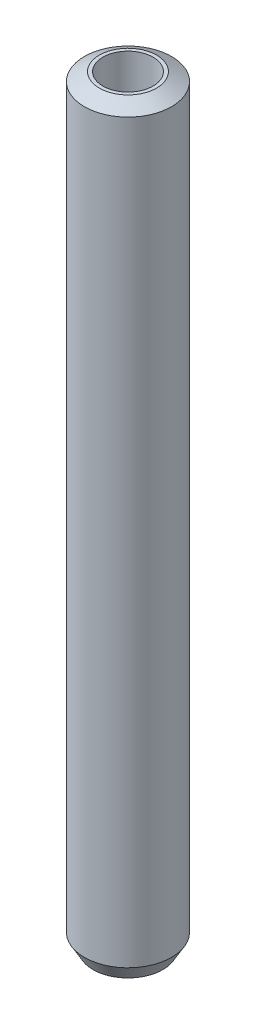
from build123d import *
from OCP.BRepFilletAPI import BRepFilletAPI_MakeChamfer

# Parameters (mm, degrees)
SKETCH1_R           = 22.5
BOSS_EXTRUDE1_DEPTH = 392.686979915
SKETCH2_R           = 12.959303446
CUT_EXTRUDE1_DEPTH  = 394.974065383
CHAMFER1_SIZE       = 4.455707117
CHAMFER1_SIZE2      = 7.717511111


with BuildPart() as part:
    # Sketch1 → Boss-Extrude1 (new body)
    with BuildSketch(Plane(origin=(0, 0, 0), x_dir=(1, 0, 0), z_dir=(0, 1, 0))):
        Circle(SKETCH1_R)
    extrude(amount=BOSS_EXTRUDE1_DEPTH)

    # Sketch2 → Cut-Extrude1 (cut, through all)
    with BuildSketch(Plane(origin=(0, 0, 0), x_dir=(1, 0, 0), z_dir=(0, 1, 0))):
        Circle(SKETCH2_R)
    extrude(amount=CUT_EXTRUDE1_DEPTH, mode=Mode.SUBTRACT)

    # Chamfer1: one chamfer whose edges measure the first distance from different faces: ONE call of the kernel's chamfer builder (chamfer() names one face for all edges)
    chamfer1_edges_1 = [part.edges().sort_by_distance(p)[0] for p in [
        (-22.5, 392.686979915, 0),
    ]]
    chamfer1_side_1 = [part.faces().sort_by_distance(p)[0] for p in [
        (-22.5, 196.343489957, 0),
    ]]
    chamfer1_edges_2 = [part.edges().sort_by_distance(p)[0] for p in [
        (-22.5, 0, 0),
    ]]
    chamfer1_side_2 = [part.faces().sort_by_distance(p)[0] for p in [
        (-21.863603897, 0, 0),
    ]]
    chamfer1 = BRepFilletAPI_MakeChamfer(part.part.solid().wrapped)
    for e in chamfer1_edges_1:
        chamfer1.Add(CHAMFER1_SIZE, CHAMFER1_SIZE2, e.wrapped, chamfer1_side_1[0].wrapped)  # the first distance lies on this face
    for e in chamfer1_edges_2:
        chamfer1.Add(CHAMFER1_SIZE, CHAMFER1_SIZE2, e.wrapped, chamfer1_side_2[0].wrapped)  # the first distance lies on this face
    add(Compound.cast(chamfer1.Shape()), mode=Mode.REPLACE)


solid = part.part
